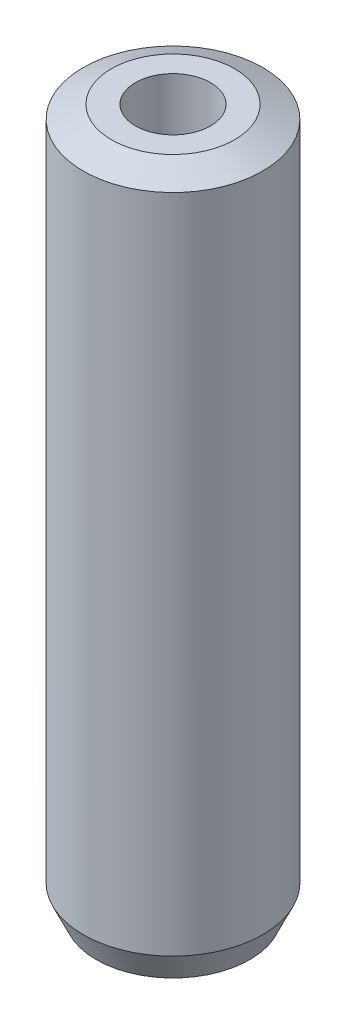
from build123d import *
from OCP.BRepFilletAPI import BRepFilletAPI_MakeChamfer

# Parameters (mm, degrees)
SKETCH1_R           = 40
BOSS_EXTRUDE1_DEPTH = 313.067838237
SKETCH2_R           = 16.735267131
CUT_EXTRUDE1_DEPTH  = 319.137503823
CHAMFER1_SIZE       = 5.800460496
CHAMFER1_SIZE2      = 12.552608407


with BuildPart() as part:
    # Sketch1 → Boss-Extrude1 (new body)
    with BuildSketch(Plane(origin=(0, 0, 0), x_dir=(1, 0, 0), z_dir=(0, 1, 0))):
        Circle(SKETCH1_R)
    extrude(amount=BOSS_EXTRUDE1_DEPTH)

    # Sketch2 → Cut-Extrude1 (cut, through all)
    with BuildSketch(Plane(origin=(0, 0, 0), x_dir=(1, 0, 0), z_dir=(0, 1, 0))):
        Circle(SKETCH2_R)
    extrude(amount=CUT_EXTRUDE1_DEPTH, mode=Mode.SUBTRACT)

    # Chamfer1: one chamfer whose edges measure the first distance from different faces: ONE call of the kernel's chamfer builder (chamfer() names one face for all edges)
    chamfer1_edges_1 = [part.edges().sort_by_distance(p)[0] for p in [
        (-40, 313.067838237, 0),
    ]]
    chamfer1_side_1 = [part.faces().sort_by_distance(p)[0] for p in [
        (-40, 156.533919119, 0),
    ]]
    chamfer1_edges_2 = [part.edges().sort_by_distance(p)[0] for p in [
        (-40, 0, 0),
    ]]
    chamfer1_side_2 = [part.faces().sort_by_distance(p)[0] for p in [
        (-38.86862915, 0, 0),
    ]]
    chamfer1 = BRepFilletAPI_MakeChamfer(part.part.solid().wrapped)
    for e in chamfer1_edges_1:
        chamfer1.Add(CHAMFER1_SIZE, CHAMFER1_SIZE2, e.wrapped, chamfer1_side_1[0].wrapped)  # the first distance lies on this face
    for e in chamfer1_edges_2:
        chamfer1.Add(CHAMFER1_SIZE, CHAMFER1_SIZE2, e.wrapped, chamfer1_side_2[0].wrapped)  # the first distance lies on this face
    add(Compound.cast(chamfer1.Shape()), mode=Mode.REPLACE)


solid = part.part
